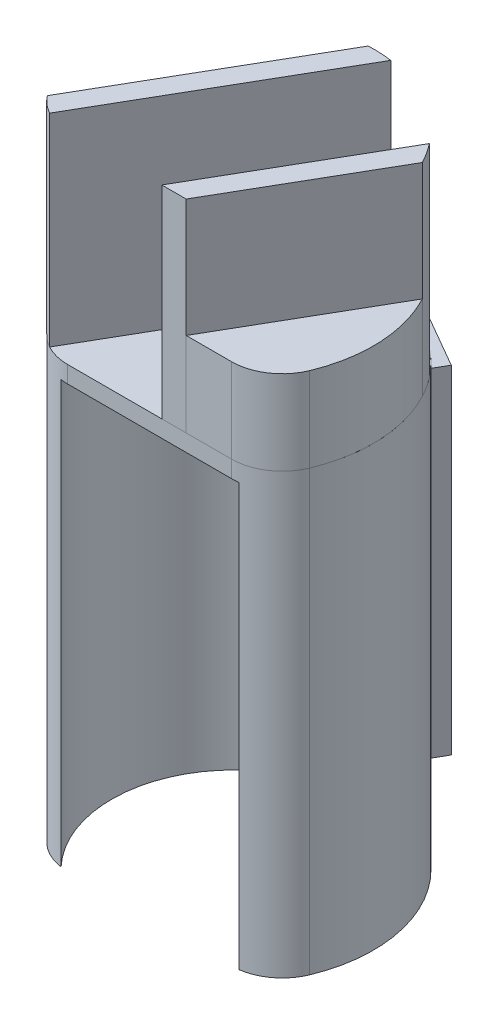
from build123d import *

# Parameters (mm, degrees)
SKETCH_1_R          = 16.5
SKETCH_1_R_2        = 14.5
EXTRUDE_1_DEPTH     = 35
SKETCH_3_R          = 16.5
EXTRUDE_2_DEPTH     = 2
SKETCH_4_W          = 78.350079852
SKETCH_4_H          = 91.802514566
CUT_EXTRUDE_1_DEPTH = 49.40970977
CUT_EXTRUDE_2_REACH = 45.744
SKETCH_5_R          = 3.75
FILLET_1_R          = 6
EXTRUDE_3_DEPTH     = 24
EXTRUDE_3_2_DEPTH   = 24
EXTRUDE_7_DEPTH     = 10
EXTRUDE_START       = 15
EXTRUDE_8_DEPTH     = 15
POS1_DEPTH          = 40
POS3_DEPTH          = 40
POS2_DEPTH          = 40


with BuildPart() as part:
    # 草图1 → 凸台-拉伸1 (new body)
    with BuildSketch(Plane(origin=(0, 0, 0), x_dir=(1, 0, 0), z_dir=(0, 1, 0))):
        Circle(SKETCH_1_R)
        Circle(SKETCH_1_R_2, mode=Mode.SUBTRACT)
    extrude(amount=EXTRUDE_1_DEPTH)

    # 草图3 → 凸台-拉伸2 (add)
    with BuildSketch(Plane(origin=(0, 35, 0), x_dir=(1, 0, 0), z_dir=(0, 1, 0))):
        Circle(SKETCH_3_R)
    extrude(amount=EXTRUDE_2_DEPTH)

    # 草图4 → 切除-拉伸1 (cut, through all)
    with BuildSketch(Plane.XY.offset(10)):
        with Locations((-10.760491613, -6.179419868)):
            Rectangle(SKETCH_4_W, SKETCH_4_H)
    extrude(amount=CUT_EXTRUDE_1_DEPTH, mode=Mode.SUBTRACT)

    # 草图5 → 切除-拉伸2 (cut, up to next)
    with BuildSketch(Plane(origin=(0, 37, 0), x_dir=(1, 0, 0), z_dir=(0, 1, 0)), mode=Mode.PRIVATE) as cut_extrude_2_sk1:
        Circle(SKETCH_5_R)
    cut_extrude_2_tool1 = extrude(cut_extrude_2_sk1.sketch, amount=-CUT_EXTRUDE_2_REACH, mode=Mode.PRIVATE) & part.part
    add(cut_extrude_2_tool1.solids().sort_by_distance((0, 37, 0))[0], mode=Mode.SUBTRACT)

    # 圆角1
    fillet_1_edges = [part.edges().sort_by_distance(p)[0] for p in [
        (-13.124404748, 18.5, 10),
        (13.124404748, 18.5, 10),
    ]]
    fillet(fillet_1_edges, radius=FILLET_1_R)

    # 草图10 → 凸台-拉伸8 (add)
    with BuildSketch(Plane.XZ.offset(EXTRUDE_START)):
        with BuildLine():
            ThreePointArc((-15.255811873, 6.285714286), (0, -16.5), (15.255811873, 6.285714286))
            ThreePointArc((15.255811873, 6.285714286), (13.391521243, 8.736398226), (10.557154474, 9.939642318))
            ThreePointArc((10.557154474, 9.939642318), (0, -14.5), (-10.557154474, 9.939642318))
            ThreePointArc((-10.557154474, 9.939642318), (-13.391521243, 8.736398226), (-15.255811873, 6.285714286))
        make_face()
    extrude(amount=-EXTRUDE_8_DEPTH)


with BuildPart() as body_2:
    # 草图6 → 凸台-拉伸3 (new body)
    with BuildSketch(Plane(origin=(0, 37, 0), x_dir=(1, 0, 0), z_dir=(0, 1, 0))):
        with BuildLine():
            Line((13.047897801, 10.099621923), (1.443375673, -10))
            Line((1.443375673, -10), (4.330127019, -10))
            Line((4.330127019, -10), (14.5721397, 7.739686335))
            ThreePointArc((14.5721397, 7.739686335), (13.860337004, 8.952153826), (13.047897801, 10.099621923))
        make_face()
    extrude(amount=EXTRUDE_3_DEPTH)


with BuildPart() as body_3:
    # 草图6 → Extrude 3 2 (new body)
    with BuildSketch(Plane(origin=(0, 37, 0), x_dir=(1, 0, 0), z_dir=(0, 1, 0))):
        with BuildLine():
            Line((-0.583304866, 16.489686335), (-14.498767089, -7.612601246))
            ThreePointArc((-14.498767089, -7.612601246), (-13.623792058, -8.546260307), (-12.570735662, -9.273152854))
            Line((-12.570735662, -9.273152854), (2.222580253, 16.349621923))
            ThreePointArc((2.222580253, 16.349621923), (0.82262413, 16.479480864), (-0.583304866, 16.489686335))
        make_face()
    extrude(amount=EXTRUDE_3_2_DEPTH)


with BuildPart() as body_4:
    # 草图9 → 凸台-拉伸7 (new body)
    with BuildSketch(Plane(origin=(0, 37, 0), x_dir=(1, 0, 0), z_dir=(0, 1, 0))):
        with BuildLine():
            Line((4.330127019, -10), (9.708243919, -10))
            ThreePointArc((9.708243919, -10), (13.046335761, -8.985693819), (15.255811873, -6.285714286))
            ThreePointArc((15.255811873, -6.285714286), (16.480432015, 0.803343383), (14.5721397, 7.739686335))
            Line((14.5721397, 7.739686335), (4.330127019, -10))
        make_face()
    extrude(amount=EXTRUDE_7_DEPTH)


with BuildPart() as body_5:
    # 草图12 → 凸台-pos1 (new body)
    with BuildSketch(Plane(origin=(0, 37, 0), x_dir=(1, 0, 0), z_dir=(0, 1, 0))):
        with BuildLine():
            Line((-16.432532581, 3.801536896), (-13.012331148, 13.198463104))
            Line((-13.012331148, 13.198463104), (-10.865728221, 12.417163534))
            ThreePointArc((-10.865728221, 12.417163534), (-14.166768538, 8.458881084), (-16.085482597, 3.675221032))
            Line((-16.085482597, 3.675221032), (-16.432532581, 3.801536896))
        make_face()
    extrude(amount=-POS1_DEPTH)


with BuildPart() as body_6:
    # 草图13 → 凸台-pos3 (new body)
    with BuildSketch(Plane(origin=(0, 37, 0), x_dir=(1, 0, 0), z_dir=(0, 1, 0))):
        with BuildLine():
            Line((4.419872981, 17.655444566), (13.080127019, 12.655444566))
            Line((13.080127019, 12.655444566), (12.192219616, 11.117543831))
            ThreePointArc((12.192219616, 11.117543831), (8.25, 14.289419162), (3.531965578, 16.117543831))
            Line((3.531965578, 16.117543831), (4.419872981, 17.655444566))
        make_face()
    extrude(amount=-POS3_DEPTH)


with BuildPart() as body_7:
    # 草图14 → 凸台-pos2 (new body)
    with BuildSketch(Plane(origin=(0, 37, 0), x_dir=(1, 0, 0), z_dir=(0, 1, 0))):
        with BuildLine():
            Line((-9.358962421, 15.609606735), (0.300295842, 18.197797186))
            Line((0.300295842, 18.197797186), (0.759910535, 16.482491801))
            ThreePointArc((0.759910535, 16.482491801), (-4.270514244, 15.937776134), (-8.899347728, 13.89430135))
            Line((-8.899347728, 13.89430135), (-9.358962421, 15.609606735))
        make_face()
    extrude(amount=-POS2_DEPTH)


solid = Compound([part.part, body_2.part, body_3.part, body_4.part, body_5.part, body_6.part, body_7.part])
